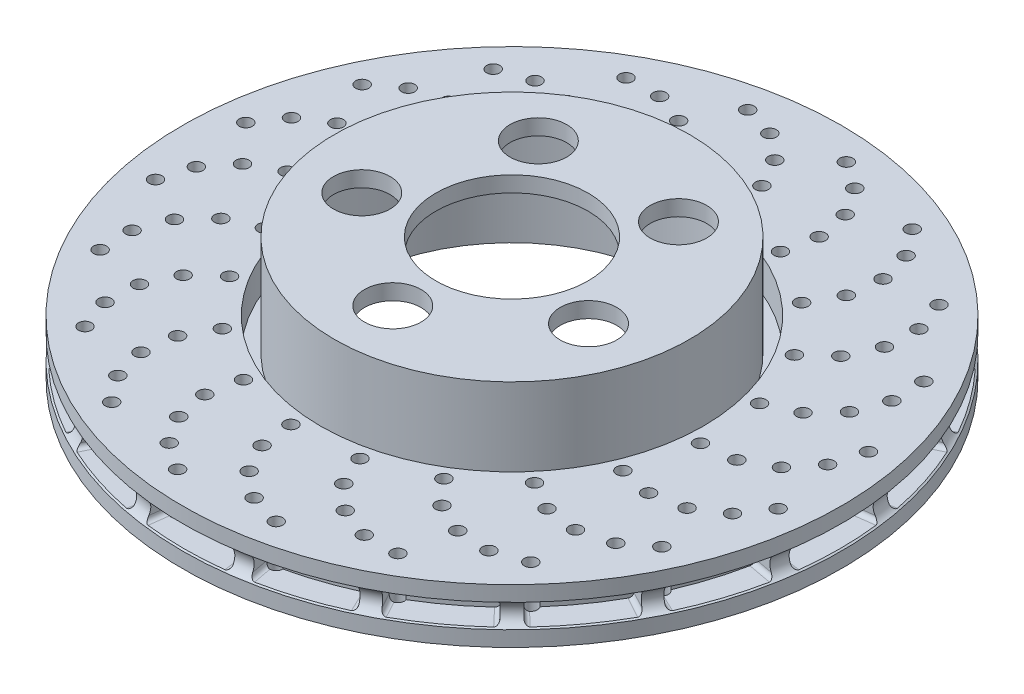
from build123d import *

# Parameters (mm, degrees)
SKETCH6_W                      = 22
SKETCH6_H                      = 10
REVOLVED_CUT2_ANGLE            = 15
RADYUS2_R                      = 2
CIRCULAR_PATTERN2_COUNT        = 20
RADYUS2_OF_CIRCULAR_PATTERN2_R = 2
SKETCH7_R                      = 6
SKETCH9_R                      = 3
CUT_EXTRUDE1_DEPTH             = 25
CURVE_START                    = -12.5
CURVE_DRIVE1_OUTLINE_R         = 3
CURVE_DRIVE1_DEPTH             = 25
CIRCULAR_KAPLAMA3_COUNT        = 20
SKETCH10_R                     = 13
CUT_EXTRUDE2_DEPTH             = 7.2


# Read off the part's stored shape, not the designer's step: Curve Drive1
with BuildPart() as part:
    # Sketch1 → Revolve1 (revolve)
    with BuildSketch(Plane.XY, mode=Mode.PRIVATE) as revolve1_sk:
        Polygon((-75, -11.5), (-75, 36.63), (-35, 36.63), (-35, 43.83), (-81.625, 43.83), (-81.625, -2.5), (-88, -2.5), (-88, 12.5), (-151.5, 12.5), (-151.5, -12.5), (-88, -12.5), (-88, -11.5), align=None)
    revolve(revolve1_sk.sketch.rotate(Axis((0, 0, 0), (0, 1, 0)), 270), axis=Axis((0, 0, 0), (0, 1, 0)))

    # Sketch6 → Revolved-Cut2 (revolve, symmetric, cut)
    with BuildSketch(Plane.XY) as revolved_cut2_sk:
        with Locations((150.5, 0)):
            Rectangle(SKETCH6_W, SKETCH6_H)
    revolved_cut2 = revolve(axis=Axis((0, 0, 0), (0, 1, 0)), revolution_arc=REVOLVED_CUT2_ANGLE / 2, mode=Mode.SUBTRACT)
    revolved_cut2 = revolved_cut2 + revolve(revolved_cut2_sk.sketch, axis=Axis((0, 0, 0), (0, -1, 0)), revolution_arc=REVOLVED_CUT2_ANGLE / 2, mode=Mode.SUBTRACT)

    # Radyus2
    radyus2_edges = [part.edges().sort_by_distance(p)[0] for p in [
        (144.25522733, -5, -18.991560968),
        (144.25522733, 5, -18.991560968),
        (144.25522733, -5, 18.991560968),
        (144.25522733, 5, 18.991560968),
    ]]
    fillet(radyus2_edges, radius=RADYUS2_R)

    # Circular Pattern2: Revolved-Cut2 ×20 about axis
    circular_pattern2_axis = Axis((0, 0, 0), (0, 1, 0))
    for i in range(1, CIRCULAR_PATTERN2_COUNT):
        add(revolved_cut2.rotate(circular_pattern2_axis, i * 360 / CIRCULAR_PATTERN2_COUNT), mode=Mode.SUBTRACT)

    # Radyus2 of Circular Pattern2
    radyus2_of_circular_pattern2_edges = [part.edges().sort_by_distance(p)[0] for p in [
        (131.326158873, -5, -62.639364586),
        (131.326158873, 5, -62.639364586),
        (143.063589051, -5, -26.515268959),
        (143.063589051, 5, -26.515268959),
        (105.541970982, -5, -100.155590763),
        (105.541970982, 5, -100.155590763),
        (127.867889892, -5, -69.426599618),
        (127.867889892, 5, -69.426599618),
        (69.426599618, -5, -127.867889892),
        (69.426599618, 5, -127.867889892),
        (100.155590763, -5, -105.541970982),
        (100.155590763, 5, -105.541970982),
        (26.515268959, -5, -143.063589051),
        (26.515268959, 5, -143.063589051),
        (62.639364586, -5, -131.326158873),
        (62.639364586, 5, -131.326158873),
        (-18.991560968, -5, -144.25522733),
        (-18.991560968, 5, -144.25522733),
        (18.991560968, -5, -144.25522733),
        (18.991560968, 5, -144.25522733),
        (-62.639364586, -5, -131.326158873),
        (-62.639364586, 5, -131.326158873),
        (-26.515268959, -5, -143.063589051),
        (-26.515268959, 5, -143.063589051),
        (-100.155590763, -5, -105.541970982),
        (-100.155590763, 5, -105.541970982),
        (-69.426599618, -5, -127.867889892),
        (-69.426599618, 5, -127.867889892),
        (-127.867889892, -5, -69.426599618),
        (-127.867889892, 5, -69.426599618),
        (-105.541970982, -5, -100.155590763),
        (-105.541970982, 5, -100.155590763),
        (-143.063589051, -5, -26.515268959),
        (-143.063589051, 5, -26.515268959),
        (-131.326158873, -5, -62.639364586),
        (-131.326158873, 5, -62.639364586),
        (-144.25522733, -5, 18.991560968),
        (-144.25522733, 5, 18.991560968),
        (-144.25522733, -5, -18.991560968),
        (-144.25522733, 5, -18.991560968),
        (-131.326158873, -5, 62.639364586),
        (-131.326158873, 5, 62.639364586),
        (-143.063589051, -5, 26.515268959),
        (-143.063589051, 5, 26.515268959),
        (-105.541970982, -5, 100.155590763),
        (-105.541970982, 5, 100.155590763),
        (-127.867889892, -5, 69.426599618),
        (-127.867889892, 5, 69.426599618),
        (-69.426599618, -5, 127.867889892),
        (-69.426599618, 5, 127.867889892),
        (-100.155590763, -5, 105.541970982),
        (-100.155590763, 5, 105.541970982),
        (-26.515268959, -5, 143.063589051),
        (-26.515268959, 5, 143.063589051),
        (-62.639364586, -5, 131.326158873),
        (-62.639364586, 5, 131.326158873),
        (18.991560968, -5, 144.25522733),
        (18.991560968, 5, 144.25522733),
        (-18.991560968, -5, 144.25522733),
        (-18.991560968, 5, 144.25522733),
        (62.639364586, -5, 131.326158873),
        (62.639364586, 5, 131.326158873),
        (26.515268959, -5, 143.063589051),
        (26.515268959, 5, 143.063589051),
        (100.155590763, -5, 105.541970982),
        (100.155590763, 5, 105.541970982),
        (69.426599618, -5, 127.867889892),
        (69.426599618, 5, 127.867889892),
        (127.867889892, -5, 69.426599618),
        (127.867889892, 5, 69.426599618),
        (105.541970982, -5, 100.155590763),
        (105.541970982, 5, 100.155590763),
        (143.063589051, -5, 26.515268959),
        (143.063589051, 5, 26.515268959),
        (131.326158873, -5, 62.639364586),
        (131.326158873, 5, 62.639364586),
    ]]
    fillet(radyus2_of_circular_pattern2_edges, radius=RADYUS2_OF_CIRCULAR_PATTERN2_R)

    # Sketch7 → Revolved-Cut3 (revolve, cut)
    with BuildSketch(Plane.XY, mode=Mode.PRIVATE) as revolved_cut3_sk:
        with Locations((154, 0)):
            Circle(SKETCH7_R)
    revolve(revolved_cut3_sk.sketch.rotate(Axis((0, 0, 0), (0, 1, 0)), 90), axis=Axis((0, 0, 0), (0, 1, 0)), mode=Mode.SUBTRACT)

    # Sketch9 → Cut-Extrude1 (cut)
    with BuildSketch(Plane.XZ.offset(12.5)):
        with Locations(Location((94.141574204, 7.491771152, 0), (0, 0, 270))):
            Circle(SKETCH9_R)
    cut_extrude1 = extrude(amount=-CUT_EXTRUDE1_DEPTH, mode=Mode.SUBTRACT)

    # Curve Drive1 outline → Curve Drive1 (cut)
    with BuildSketch(Plane(origin=(0, 0, 0), x_dir=(1, 0, 0), z_dir=(0, 1, 0)).offset(CURVE_START)):
        with Locations((109.136856952, -5.759589976)):
            Circle(CURVE_DRIVE1_OUTLINE_R)
        with Locations((122.356069023, 1.528166095)):
            Circle(CURVE_DRIVE1_OUTLINE_R)
        with Locations((131.82561122, 13.283451158)):
            Circle(CURVE_DRIVE1_OUTLINE_R)
        with Locations((136.131701786, 27.751227088)):
            Circle(CURVE_DRIVE1_OUTLINE_R)
    curve_drive1 = extrude(amount=CURVE_DRIVE1_DEPTH, mode=Mode.SUBTRACT)

    # Circular Kaplama3: Cut-Extrude1, Curve Drive1 ×20 about axis
    circular_kaplama3_axis = Axis((0, 0, 0), (0, 1, 0))
    add([cut_extrude1.rotate(circular_kaplama3_axis, i * 360 / CIRCULAR_KAPLAMA3_COUNT) for i in range(1, CIRCULAR_KAPLAMA3_COUNT)], mode=Mode.SUBTRACT)
    add([curve_drive1.rotate(circular_kaplama3_axis, i * 360 / CIRCULAR_KAPLAMA3_COUNT) for i in range(1, CIRCULAR_KAPLAMA3_COUNT)], mode=Mode.SUBTRACT)

    # Sketch10 → Cut-Extrude2 (cut)
    with BuildSketch(Plane(origin=(0, 43.83, 0), x_dir=(1, 0, 0), z_dir=(0, 1, 0))):
        with Locations(Location((-32.209638072, 44.332763508, 0), (0, 0, 270))):
            Circle(SKETCH10_R)
        with Locations(Location((-52.116289167, -16.933608845, 0), (0, 0, 270))):
            Circle(SKETCH10_R)
        with Locations(Location((0, -54.798309326, 0), (0, 0, 270))):
            Circle(SKETCH10_R)
        with Locations(Location((52.116289167, -16.933608845, 0), (0, 0, 270))):
            Circle(SKETCH10_R)
        with Locations(Location((32.209638072, 44.332763508, 0), (0, 0, 270))):
            Circle(SKETCH10_R)
    extrude(amount=-CUT_EXTRUDE2_DEPTH, mode=Mode.SUBTRACT)


solid = part.part
